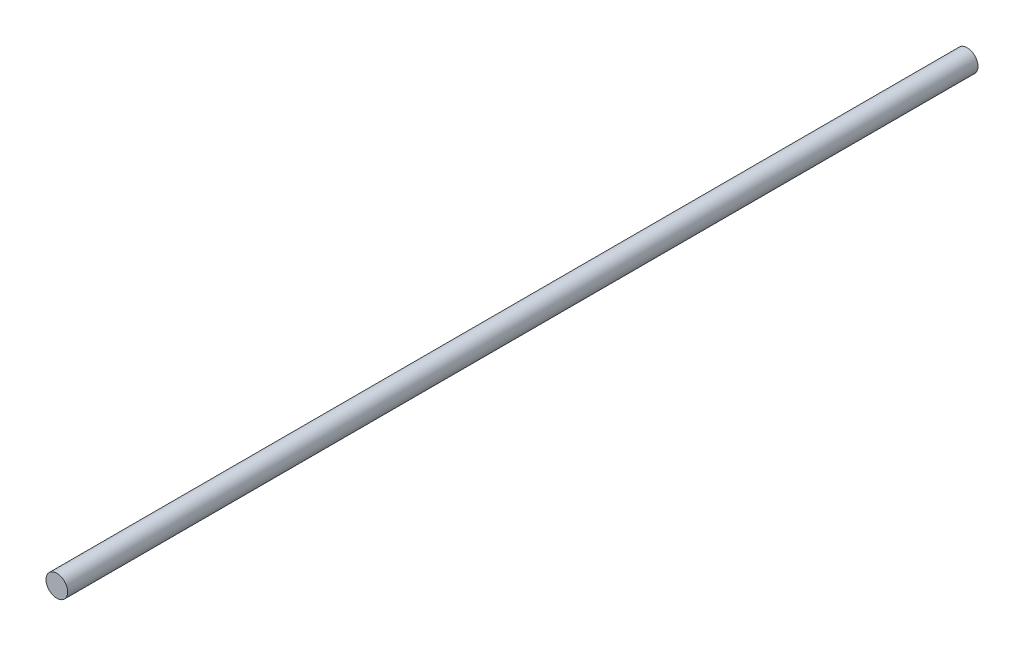
from build123d import *

# Parameters (mm, degrees)
SKETCH2_W = 335.62767539
SKETCH2_H = 4


with BuildPart() as part:
    # Sketch2 → Revolve1 (revolve)
    with BuildSketch(Plane(origin=(0, 0, 0), x_dir=(0, 0, -1), z_dir=(1, 0, 0))):
        with Locations((160.013837695, 2)):
            Rectangle(SKETCH2_W, SKETCH2_H)
    revolve(axis=Axis((0, 0, 7.8), (0, 0, -1)))


solid = part.part
